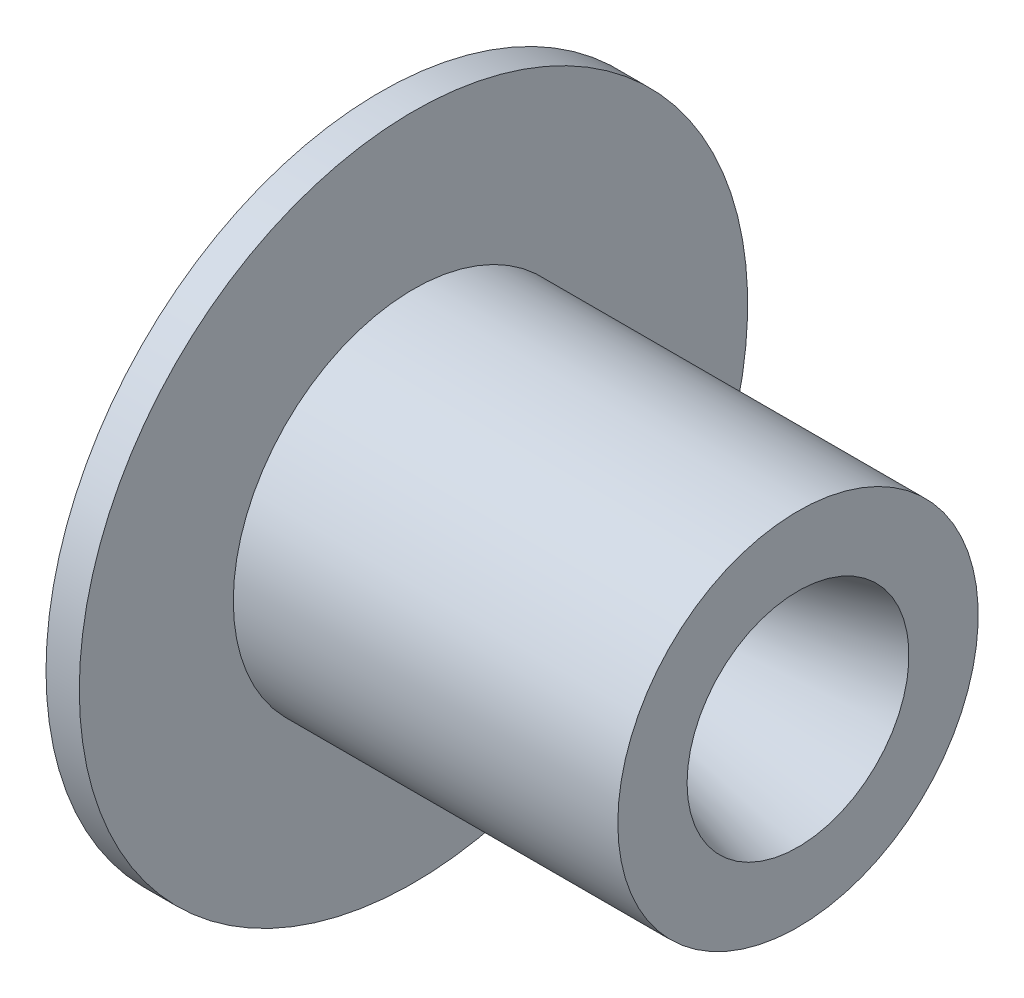
from build123d import *

# Parameters (mm, degrees)
RAO_INLET_RADIUS_R  = 20.8
RAO_OUTLET_RADIUS_R = 5.306744


with BuildPart() as part:
    # Sketch1 → Nozzle (revolve)
    with BuildSketch(Plane.XY):
        Polygon((20, 9.421166631), (26.5, 9.421166631), (63.760795263, 19.405166631), (63.760795263, 29.975166631), (5.08, 29.975166631), (5.08, 53.475166631), (0, 53.475166631), (0, 27.875166631), align=None)
    revolve(axis=Axis((-1.458033798, 2.475166631, 0), (1, 0, 0)))

    # Rao inlet radius
    rao_inlet_radius_edges = [part.edges().sort_by_distance(p)[0] for p in [
        (26.5, -4.470833369, 0),
    ]]
    fillet(rao_inlet_radius_edges, radius=RAO_INLET_RADIUS_R)

    # Rao outlet radius
    rao_outlet_radius_edges = [part.edges().sort_by_distance(p)[0] for p in [
        (20, -4.470833369, 0),
    ]]
    fillet(rao_outlet_radius_edges, radius=RAO_OUTLET_RADIUS_R)


solid = part.part
